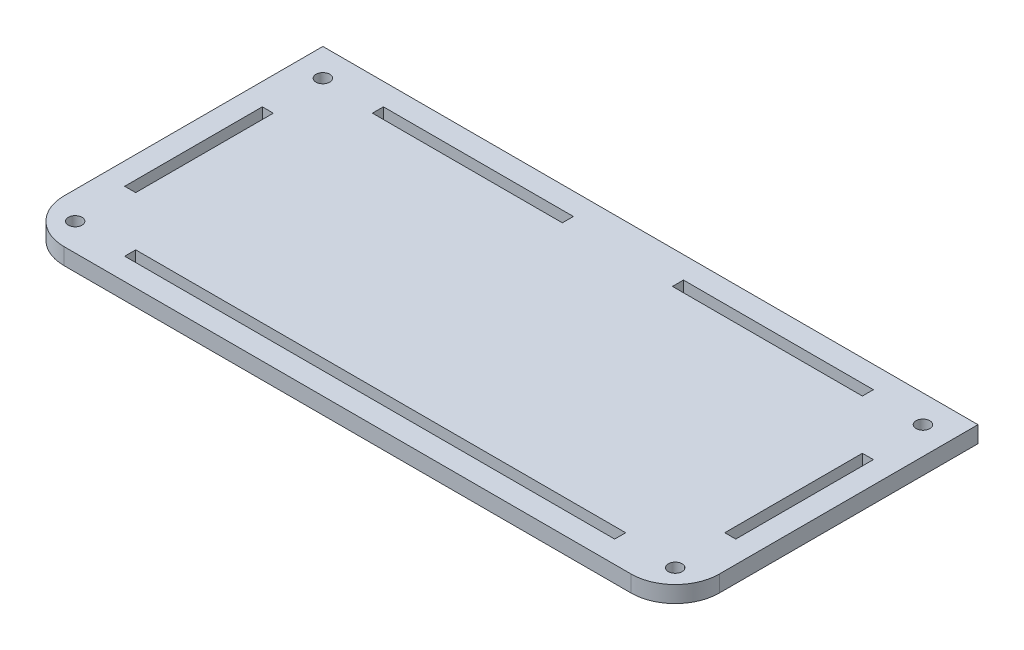
from build123d import *

# Parameters (mm, degrees)
SCHIZZO1_W                   = 119
SCHIZZO1_H                   = 55
ESTRUSIONE_ESTRUSIONE1_DEPTH = 3
FORO_FILETTATO_M3X0_5_1_D    = 2.5
SCHIZZO4_W                   = 89
SCHIZZO4_H                   = 2
SCHIZZO4_W_2                 = 2
SCHIZZO4_H_2                 = 25
TAGLIO_ESTRUSIONE1_DEPTH     = 66.616308948
RACCORDO1_R                  = 8
SCHIZZO5_W                   = 34.5
SCHIZZO5_H                   = 2
TAGLIO_ESTRUSIONE2_DEPTH     = 10


with BuildPart() as part:
    # Schizzo1 → Estrusione-Estrusione1 (new body)
    with BuildSketch(Plane(origin=(0, 0, 0), x_dir=(1, 0, 0), z_dir=(0, 1, 0))):
        Rectangle(SCHIZZO1_W, SCHIZZO1_H)
    extrude(amount=ESTRUSIONE_ESTRUSIONE1_DEPTH)

    # Foro filettato M3x0.5-1 (through all)
    with Locations(Plane(origin=(0, 3, 0), x_dir=(1, 0, 0), z_dir=(0, 1, 0))):
        with Locations((-54.5, -22.5), (54.5, -22.5), (54.5, 22.5), (-54.5, 22.5)):
            Hole(FORO_FILETTATO_M3X0_5_1_D / 2)

    # Schizzo4 → Taglio-Estrusione1 (cut, through all)
    with BuildSketch(Plane(origin=(0, 3, 0), x_dir=(1, 0, 0), z_dir=(0, 1, 0))):
        with Locations((0, -22.5)):
            Rectangle(SCHIZZO4_W, SCHIZZO4_H)
        with Locations((54.5, 0)):
            Rectangle(SCHIZZO4_W_2, SCHIZZO4_H_2)
        with Locations((-54.5, 0)):
            Rectangle(SCHIZZO4_W_2, SCHIZZO4_H_2)
    extrude(amount=-TAGLIO_ESTRUSIONE1_DEPTH, mode=Mode.SUBTRACT)

    # Raccordo1
    raccordo1_edges = [part.edges().sort_by_distance(p)[0] for p in [
        (-59.5, 1.5, 27.5),
        (59.5, 1.5, 27.5),
    ]]
    fillet(raccordo1_edges, radius=RACCORDO1_R)

    # Schizzo5 → Taglio-Estrusione2 (cut)
    with BuildSketch(Plane(origin=(0, 3, 0), x_dir=(1, 0, 0), z_dir=(0, 1, 0))):
        with Locations((27.25, 22.5)):
            Rectangle(SCHIZZO5_W, SCHIZZO5_H)
        with Locations((-27.25, 22.5)):
            Rectangle(SCHIZZO5_W, SCHIZZO5_H)
    extrude(amount=-TAGLIO_ESTRUSIONE2_DEPTH, mode=Mode.SUBTRACT)


solid = part.part
